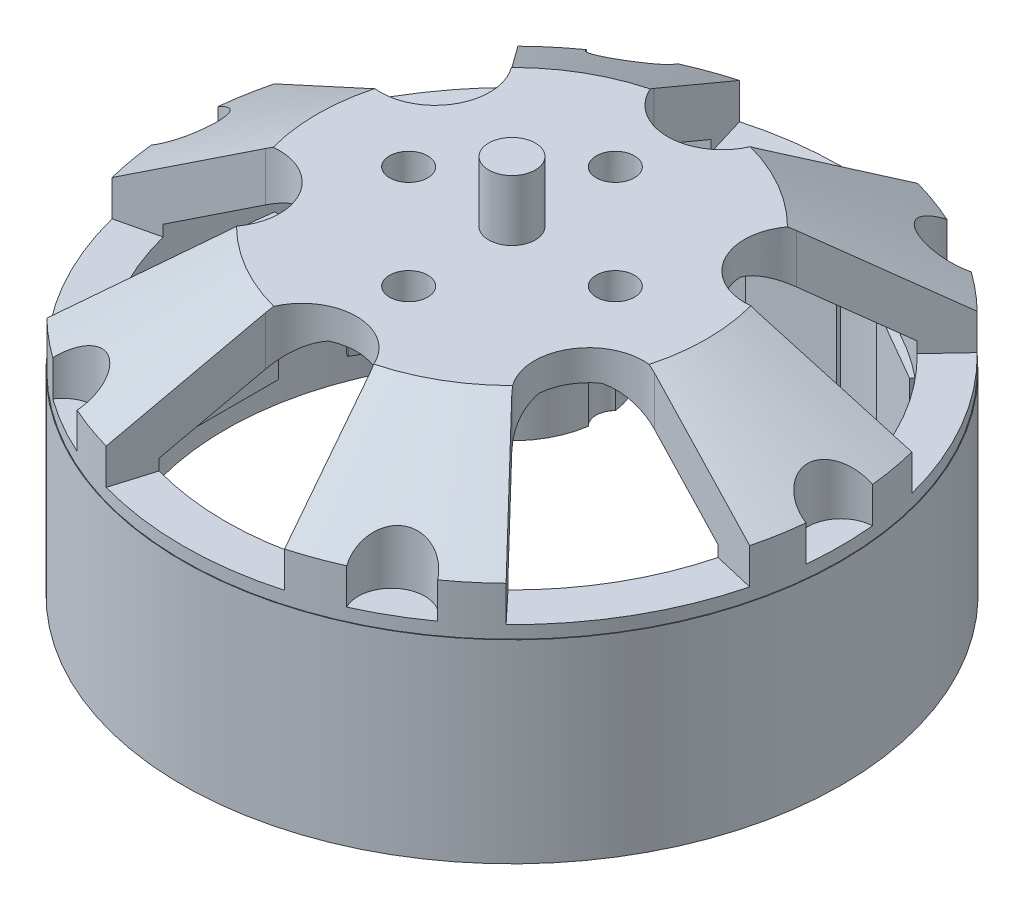
from build123d import *

# Parameters (mm, degrees)
SHELL2_T                   = -1.778
CUT_EXTRUDE1_START         = -5.1816
CUT_EXTRUDE1_DEPTH         = 5.1816
CUT_EXTRUDE2_REACH         = 27.055
SKETCH6_R                  = 8.15975
BOSS_EXTRUDE4_DEPTH        = 1.27
SKETCH7_R                  = 1.397
CUT_EXTRUDE3_DEPTH         = 4.699
SKETCH20_R                 = 3.81
BOSS_EXTRUDE9_DEPTH        = 3.81
SKETCH12_W                 = 0.8
SKETCH12_H                 = 20.574
M2_TAPPED_HOLE1_AT_2_COUNT = 2
M2_TAPPED_HOLE1_AT_2_PITCH = 6.1214
M2_TAPPED_HOLE1_AT_3_COUNT = 2
M2_TAPPED_HOLE1_AT_3_PITCH = 8.656967
M2_TAPPED_HOLE1_AT_4_COUNT = 2
M2_TAPPED_HOLE1_AT_4_PITCH = 6.1214
SKETCH13_R                 = 0.9779
BOSS_EXTRUDE5_DEPTH        = 2.54
SKETCH16_R                 = 22.480188
CUT_EXTRUDE4_DEPTH         = 7.2136
CUT_EXTRUDE5_START         = -1.778
SKETCH17_R                 = 12.0015
CUT_EXTRUDE5_DEPTH         = 1.778
BOSS_EXTRUDE8_REACH        = 43.917
BOSS_EXTRUDE8_END_RADIUS   = 12.0015
BOSS_EXTRUDE8_START        = 11.684
SKETCH18_W                 = 3.81
SKETCH18_H                 = 5.9944
SKETCH19_W                 = 0.0254
SKETCH19_H                 = 8.128
CIRPATTERN1_START          = 8.2296
CIRPATTERN1_DEPTH          = 5.9944


# Read off the part's stored shape, not the designer's step: Cut-Extrude1, CirPattern1
with BuildPart() as part:
    # Sketch2 → Revolve1 (revolve)
    with BuildSketch(Plane.XY, mode=Mode.PRIVATE) as revolve1_sk:
        Polygon((0, 0), (12.36345, 0), (13.7795, 5.1054), (13.7795, 6.604), (11.2395, 6.604), (11.2395, 7.2136), (13.7795, 7.2136), (13.7795, 17.3736), (8.15975, 20.574), (0, 20.574), align=None)
    revolve(revolve1_sk.sketch.rotate(Axis((0, 20.574, 0), (0, -1, 0)), 180), axis=Axis((0, 20.574, 0), (0, -1, 0)))

    # Shell2
    shell2_openings = [part.faces().sort_by_distance(p)[0] for p in [
        (0, 20.574, 0),
    ]]
    offset(amount=SHELL2_T, openings=shell2_openings, kind=Kind.INTERSECTION)

    # Cut-Extrude1 outline → Cut-Extrude1 (cut)
    with BuildSketch(Plane.XZ.offset(CUT_EXTRUDE1_START)):
        with BuildLine():
            ThreePointArc((-10.981091, 1.744842), (-11.11885, 0), (-10.981091, -1.744842))
            ThreePointArc((-10.981091, -1.744842), (-10.198703, -3.156227), (-8.692687, -3.73593))
            ThreePointArc((-8.692687, -3.73593), (-6.866081, -2.924695), (-6.315225, -1.003458))
            ThreePointArc((-6.315225, -1.003458), (-6.39445, 0), (-6.315225, 1.003458))
            ThreePointArc((-6.315225, 1.003458), (-6.866081, 2.924695), (-8.692687, 3.73593))
            ThreePointArc((-8.692687, 3.73593), (-10.198703, 3.156227), (-10.981091, 1.744842))
        make_face()
        with BuildLine():
            ThreePointArc((1.744842, -10.981091), (3.156227, -10.198703), (3.73593, -8.692687))
            ThreePointArc((3.73593, -8.692687), (2.924695, -6.866081), (1.003458, -6.315225))
            ThreePointArc((1.003458, -6.315225), (0, -6.39445), (-1.003458, -6.315225))
            ThreePointArc((-1.003458, -6.315225), (-2.924695, -6.866081), (-3.73593, -8.692687))
            ThreePointArc((-3.73593, -8.692687), (-3.156227, -10.198703), (-1.744842, -10.981091))
            ThreePointArc((-1.744842, -10.981091), (0, -11.11885), (1.744842, -10.981091))
        make_face()
        with BuildLine():
            ThreePointArc((1.003458, 6.315225), (2.924695, 6.866081), (3.73593, 8.692687))
            ThreePointArc((3.73593, 8.692687), (3.156227, 10.198703), (1.744842, 10.981091))
            ThreePointArc((1.744842, 10.981091), (0, 11.11885), (-1.744842, 10.981091))
            ThreePointArc((-1.744842, 10.981091), (-3.156227, 10.198703), (-3.73593, 8.692687))
            ThreePointArc((-3.73593, 8.692687), (-2.924695, 6.866081), (-1.003458, 6.315225))
            ThreePointArc((-1.003458, 6.315225), (0, 6.39445), (1.003458, 6.315225))
        make_face()
        with BuildLine():
            ThreePointArc((10.981091, 1.744842), (10.198703, 3.156227), (8.692687, 3.73593))
            ThreePointArc((8.692687, 3.73593), (6.866081, 2.924695), (6.315225, 1.003458))
            ThreePointArc((6.315225, 1.003458), (6.39445, 0), (6.315225, -1.003458))
            ThreePointArc((6.315225, -1.003458), (6.866081, -2.924695), (8.692687, -3.73593))
            ThreePointArc((8.692687, -3.73593), (10.198703, -3.156227), (10.981091, -1.744842))
            ThreePointArc((10.981091, -1.744842), (11.11885, 0), (10.981091, 1.744842))
        make_face()
        with BuildLine():
            Line((-5.791455, -12.503346), (-5.009995, -11.332974))
            ThreePointArc((-5.009995, -11.332974), (-4.953075, -10.703733), (-5.357766, -10.218543))
            ThreePointArc((-5.357766, -10.218543), (-8.158563, -8.158563), (-10.218543, -5.357766))
            ThreePointArc((-10.218543, -5.357766), (-10.703733, -4.953075), (-11.332974, -5.009995))
            Line((-11.332974, -5.009995), (-12.503346, -5.791455))
            ThreePointArc((-12.503346, -5.791455), (-9.743578, -9.743578), (-5.791455, -12.503346))
        make_face()
        with BuildLine():
            Line((5.106817, -11.477982), (5.791455, -12.503346))
            ThreePointArc((5.791455, -12.503346), (9.743578, -9.743578), (12.503346, -5.791455))
            Line((12.503346, -5.791455), (11.477982, -5.106817))
            ThreePointArc((11.477982, -5.106817), (10.788331, -4.931511), (10.218543, -5.357766))
            ThreePointArc((10.218543, -5.357766), (8.158563, -8.158563), (5.357766, -10.218543))
            ThreePointArc((5.357766, -10.218543), (4.931511, -10.788331), (5.106817, -11.477982))
        make_face()
        with BuildLine():
            ThreePointArc((-5.791455, 12.503346), (-9.743578, 9.743578), (-12.503346, 5.791455))
            Line((-12.503346, 5.791455), (-11.477982, 5.106817))
            ThreePointArc((-11.477982, 5.106817), (-10.788331, 4.931511), (-10.218543, 5.357766))
            ThreePointArc((-10.218543, 5.357766), (-8.158563, 8.158563), (-5.357766, 10.218543))
            ThreePointArc((-5.357766, 10.218543), (-4.931511, 10.788331), (-5.106817, 11.477982))
            Line((-5.106817, 11.477982), (-5.791455, 12.503346))
        make_face()
        with BuildLine():
            ThreePointArc((12.503346, 5.791455), (9.743578, 9.743578), (5.791455, 12.503346))
            Line((5.791455, 12.503346), (5.009995, 11.332974))
            ThreePointArc((5.009995, 11.332974), (4.953075, 10.703733), (5.357766, 10.218543))
            ThreePointArc((5.357766, 10.218543), (8.158563, 8.158563), (10.218543, 5.357766))
            ThreePointArc((10.218543, 5.357766), (10.703733, 4.953075), (11.332974, 5.009995))
            Line((11.332974, 5.009995), (12.503346, 5.791455))
        make_face()
    extrude(amount=CUT_EXTRUDE1_DEPTH, mode=Mode.SUBTRACT)

    # Sketch4 → Cut-Extrude2 (cut, up to next)
    with BuildSketch(Plane.XZ.offset(-4.826), mode=Mode.PRIVATE) as cut_extrude2_sk1:
        with BuildLine():
            ThreePointArc((-10.782082, 4.932781), (-10.452601, 5.082007), (-10.218543, 5.357766))
            ThreePointArc((-10.218543, 5.357766), (-8.158563, 8.158563), (-5.357766, 10.218543))
            ThreePointArc((-5.357766, 10.218543), (-5.082007, 10.452601), (-4.932781, 10.782082))
            ThreePointArc((-4.932781, 10.782082), (0, 11.856881), (4.932781, 10.782082))
            ThreePointArc((4.932781, 10.782082), (5.082007, 10.452601), (5.357766, 10.218543))
            ThreePointArc((5.357766, 10.218543), (8.158563, 8.158563), (10.218543, 5.357766))
            ThreePointArc((10.218543, 5.357766), (10.452601, 5.082007), (10.782082, 4.932781))
            ThreePointArc((10.782082, 4.932781), (11.856881, 0), (10.782082, -4.932781))
            ThreePointArc((10.782082, -4.932781), (10.452601, -5.082007), (10.218543, -5.357766))
            ThreePointArc((10.218543, -5.357766), (8.158563, -8.158563), (5.357766, -10.218543))
            ThreePointArc((5.357766, -10.218543), (5.082007, -10.452601), (4.932781, -10.782082))
            ThreePointArc((4.932781, -10.782082), (0, -11.856881), (-4.932781, -10.782082))
            ThreePointArc((-4.932781, -10.782082), (-5.082007, -10.452601), (-5.357766, -10.218543))
            ThreePointArc((-5.357766, -10.218543), (-8.158563, -8.158563), (-10.218543, -5.357766))
            ThreePointArc((-10.218543, -5.357766), (-10.452601, -5.082007), (-10.782082, -4.932781))
            ThreePointArc((-10.782082, -4.932781), (-11.856881, 0), (-10.782082, 4.932781))
        make_face()
    cut_extrude2_tool1 = extrude(cut_extrude2_sk1.sketch, amount=-CUT_EXTRUDE2_REACH, mode=Mode.PRIVATE) & part.part
    add(cut_extrude2_tool1.solids().sort_by_distance((0, 4.826, 0))[0], mode=Mode.SUBTRACT)


with BuildPart() as cut_extrude2_piece_1:
    # of the separate pieces the step leaves, piece 1, a body of its own (cut_extrude2_pieces)
    add(part.part.solids().sort_by_distance((-12.0015, 8.9916, 0))[0])

    # Sketch6 → Boss-Extrude4 (add)
    with BuildSketch(Plane(origin=(0, 20.574, 0), x_dir=(1, 0, 0), z_dir=(0, 1, 0))):
        Circle(SKETCH6_R)
    extrude(amount=-BOSS_EXTRUDE4_DEPTH)

    # Sketch7 → Cut-Extrude3 (cut)
    with BuildSketch(Plane(origin=(0, 20.574, 0), x_dir=(1, 0, 0), z_dir=(0, 1, 0))):
        with Locations((6.88975, 11.933397)):
            Circle(SKETCH7_R)
        with Locations((13.7795, 0)):
            Circle(SKETCH7_R)
        with Locations((6.88975, -11.933397)):
            Circle(SKETCH7_R)
        with Locations((-6.88975, -11.933397)):
            Circle(SKETCH7_R)
        with Locations((-13.7795, 0)):
            Circle(SKETCH7_R)
        with Locations((-6.88975, 11.933397)):
            Circle(SKETCH7_R)
        with BuildLine():
            Line((-2.188465, 8.14048), (-3.890684, 13.7795))
            Line((-3.890684, 13.7795), (3.890684, 13.7795))
            Line((3.890684, 13.7795), (2.188465, 8.14048))
            ThreePointArc((2.188465, 8.14048), (0, 6.5151), (-2.188465, 8.14048))
        make_face()
        with BuildLine():
            Line((5.95563, 5.965506), (9.988055, 10.259182))
            Line((9.988055, 10.259182), (13.878739, 3.520318))
            Line((13.878739, 3.520318), (8.144095, 2.174974))
            ThreePointArc((8.144095, 2.174974), (5.642242, 3.25755), (5.95563, 5.965506))
        make_face()
        with BuildLine():
            Line((8.144095, -2.174974), (13.878739, -3.520318))
            Line((13.878739, -3.520318), (9.988055, -10.259182))
            Line((9.988055, -10.259182), (5.95563, -5.965506))
            ThreePointArc((5.95563, -5.965506), (5.642242, -3.25755), (8.144095, -2.174974))
        make_face()
        with BuildLine():
            Line((2.188465, -8.14048), (3.890684, -13.7795))
            Line((3.890684, -13.7795), (-3.890684, -13.7795))
            Line((-3.890684, -13.7795), (-2.188465, -8.14048))
            ThreePointArc((-2.188465, -8.14048), (0, -6.5151), (2.188465, -8.14048))
        make_face()
        with BuildLine():
            Line((-5.95563, -5.965506), (-9.988055, -10.259182))
            Line((-9.988055, -10.259182), (-13.878739, -3.520318))
            Line((-13.878739, -3.520318), (-8.144095, -2.174974))
            ThreePointArc((-8.144095, -2.174974), (-5.642242, -3.25755), (-5.95563, -5.965506))
        make_face()
        with BuildLine():
            Line((-8.144095, 2.174974), (-13.878739, 3.520318))
            Line((-13.878739, 3.520318), (-9.988055, 10.259182))
            Line((-9.988055, 10.259182), (-5.95563, 5.965506))
            ThreePointArc((-5.95563, 5.965506), (-5.642242, 3.25755), (-8.144095, 2.174974))
        make_face()
    extrude(amount=-CUT_EXTRUDE3_DEPTH, mode=Mode.SUBTRACT)

    # Sketch20 → Boss-Extrude9 (add)
    with BuildSketch(Plane.XZ.offset(-19.304)):
        with Locations(Location((0, 0, 0), (0, 0, 180))):
            Circle(SKETCH20_R)
    extrude(amount=BOSS_EXTRUDE9_DEPTH)

    # Sketch12 → M2 Tapped Hole1 (revolve, cut)
    with BuildSketch(Plane(origin=(0, 20.574, -4.328483), x_dir=(0, 0, 1), z_dir=(1, 0, 0))):
        with Locations((0.4, 10.287)):
            Rectangle(SKETCH12_W, SKETCH12_H)
    m2_tapped_hole1 = revolve(axis=Axis((0, 26.924, -4.328483), (0, -1, 0)), mode=Mode.SUBTRACT)

    # M2 Tapped Hole1 at 2: M2 Tapped Hole1 ×2
    with Locations(*[Vector(0.7071067811865475, 0, 0.7071067811865476) * (i * M2_TAPPED_HOLE1_AT_2_PITCH) for i in range(1, M2_TAPPED_HOLE1_AT_2_COUNT)]):
        add(m2_tapped_hole1, mode=Mode.SUBTRACT)

    # M2 Tapped Hole1 at 3: M2 Tapped Hole1 ×2
    with Locations(*[(0, 0, i * M2_TAPPED_HOLE1_AT_3_PITCH) for i in range(1, M2_TAPPED_HOLE1_AT_3_COUNT)]):
        add(m2_tapped_hole1, mode=Mode.SUBTRACT)

    # M2 Tapped Hole1 at 4: M2 Tapped Hole1 ×2
    with Locations(*[Vector(-0.7071067811865474, 0, 0.7071067811865477) * (i * M2_TAPPED_HOLE1_AT_4_PITCH) for i in range(1, M2_TAPPED_HOLE1_AT_4_COUNT)]):
        add(m2_tapped_hole1, mode=Mode.SUBTRACT)

    # Sketch13 → Boss-Extrude5 (add)
    with BuildSketch(Plane(origin=(0, 20.574, 0), x_dir=(1, 0, 0), z_dir=(0, 1, 0))):
        Circle(SKETCH13_R)
    extrude(amount=BOSS_EXTRUDE5_DEPTH)

    # Sketch17 → Cut-Extrude5 (cut)
    with BuildSketch(Plane.XZ.offset(-7.2136).offset(CUT_EXTRUDE5_START)):
        with Locations(Location((0, 0, 0), (0, 0, 194.431668))):
            Circle(SKETCH17_R)
    extrude(amount=CUT_EXTRUDE5_DEPTH, mode=Mode.SUBTRACT)

    # Boss-Extrude8: up to this cylinder (the profile starts inside it)
    boss_extrude8_end = Plane(origin=(0, 11.2268, 0), z_dir=(0, 1, 0)) * Cylinder(BOSS_EXTRUDE8_END_RADIUS, 112.837, mode=Mode.PRIVATE)
    # Sketch18 → Boss-Extrude8 (add, up to the surface)
    with BuildSketch(Plane.XY.offset(BOSS_EXTRUDE8_START), mode=Mode.PRIVATE) as boss_extrude8_sk1:
        with Locations((0, 11.2268)):
            Rectangle(SKETCH18_W, SKETCH18_H)
    boss_extrude8_tool1 = extrude(boss_extrude8_sk1.sketch, amount=BOSS_EXTRUDE8_REACH, mode=Mode.PRIVATE) & boss_extrude8_end
    add(boss_extrude8_tool1.solids().sort_by_distance((0, 11.2268, 11.684))[0])

    # Sketch19 → Revolve2 (revolve)
    with BuildSketch(Plane.XY, mode=Mode.PRIVATE) as revolve2_sk:
        with Locations((-13.7922, 11.2776)):
            Rectangle(SKETCH19_W, SKETCH19_H)
    revolve(revolve2_sk.sketch.rotate(Axis((0, 8.9916, 0), (0, 1, 0)), 345.568332), axis=Axis((0, 8.9916, 0), (0, 1, 0)))

    # CirPattern1 outline → CirPattern1 (add)
    with BuildSketch(Plane(origin=(0, 0, 0), x_dir=(1, 0, 0), z_dir=(0, 1, 0)).offset(CIRPATTERN1_START)):
        with BuildLine():
            Line((-1.905, 11.849345), (-1.905, 11.684))
            Line((-1.905, 11.684), (1.905, 11.684))
            Line((1.905, 11.684), (1.905, 11.849345))
            ThreePointArc((1.905, 11.849345), (0, 12.0015), (-1.905, 11.849345))
        make_face()
        with BuildLine():
            Line((-4.192222, 11.071141), (-4.274894, 11.214334))
            ThreePointArc((-4.274894, 11.214334), (-6.00075, 10.393604), (-7.574451, 9.309334))
            Line((-7.574451, 9.309334), (-7.491778, 9.166141))
            Line((-7.491778, 9.166141), (-4.192222, 11.071141))
        make_face()
        with BuildLine():
            ThreePointArc((7.574451, 9.309334), (6.00075, 10.393604), (4.274894, 11.214334))
            Line((4.274894, 11.214334), (4.192222, 11.071141))
            Line((4.192222, 11.071141), (7.491778, 9.166141))
            Line((7.491778, 9.166141), (7.574451, 9.309334))
        make_face()
        with BuildLine():
            Line((-9.166141, 7.491778), (-9.309334, 7.574451))
            ThreePointArc((-9.309334, 7.574451), (-10.393604, 6.00075), (-11.214334, 4.274894))
            Line((-11.214334, 4.274894), (-11.071141, 4.192222))
            Line((-11.071141, 4.192222), (-9.166141, 7.491778))
        make_face()
        with BuildLine():
            ThreePointArc((11.214334, 4.274894), (10.393604, 6.00075), (9.309334, 7.574451))
            Line((9.309334, 7.574451), (9.166141, 7.491778))
            Line((9.166141, 7.491778), (11.071141, 4.192222))
            Line((11.071141, 4.192222), (11.214334, 4.274894))
        make_face()
        with BuildLine():
            Line((-11.684, 1.905), (-11.849345, 1.905))
            ThreePointArc((-11.849345, 1.905), (-12.0015, 0), (-11.849345, -1.905))
            Line((-11.849345, -1.905), (-11.684, -1.905))
            Line((-11.684, -1.905), (-11.684, 1.905))
        make_face()
        with BuildLine():
            ThreePointArc((11.849345, -1.905), (12.0015, 0), (11.849345, 1.905))
            Line((11.849345, 1.905), (11.684, 1.905))
            Line((11.684, 1.905), (11.684, -1.905))
            Line((11.684, -1.905), (11.849345, -1.905))
        make_face()
        with BuildLine():
            Line((-11.071141, -4.192222), (-11.214334, -4.274894))
            ThreePointArc((-11.214334, -4.274894), (-10.393604, -6.00075), (-9.309334, -7.574451))
            Line((-9.309334, -7.574451), (-9.166141, -7.491778))
            Line((-9.166141, -7.491778), (-11.071141, -4.192222))
        make_face()
        with BuildLine():
            ThreePointArc((9.309334, -7.574451), (10.393604, -6.00075), (11.214334, -4.274894))
            Line((11.214334, -4.274894), (11.071141, -4.192222))
            Line((11.071141, -4.192222), (9.166141, -7.491778))
            Line((9.166141, -7.491778), (9.309334, -7.574451))
        make_face()
        with BuildLine():
            Line((-7.491778, -9.166141), (-7.574451, -9.309334))
            ThreePointArc((-7.574451, -9.309334), (-6.00075, -10.393604), (-4.274894, -11.214334))
            Line((-4.274894, -11.214334), (-4.192222, -11.071141))
            Line((-4.192222, -11.071141), (-7.491778, -9.166141))
        make_face()
        with BuildLine():
            ThreePointArc((4.274894, -11.214334), (6.00075, -10.393604), (7.574451, -9.309334))
            Line((7.574451, -9.309334), (7.491778, -9.166141))
            Line((7.491778, -9.166141), (4.192222, -11.071141))
            Line((4.192222, -11.071141), (4.274894, -11.214334))
        make_face()
    extrude(amount=CIRPATTERN1_DEPTH)


with BuildPart() as cut_extrude2_piece_2:
    # of the separate pieces the step leaves, piece 2, a body of its own (cut_extrude2_pieces)
    add(part.part.solids().sort_by_distance((-10.218543, 0, -5.357766))[0])

    # Sketch16 → Cut-Extrude4 (cut)
    with BuildSketch(Plane(origin=(0, 0, 0), x_dir=(1, 0, 0), z_dir=(0, 1, 0))):
        Circle(SKETCH16_R)
    extrude(amount=CUT_EXTRUDE4_DEPTH, mode=Mode.SUBTRACT)


solid = cut_extrude2_piece_1.part
